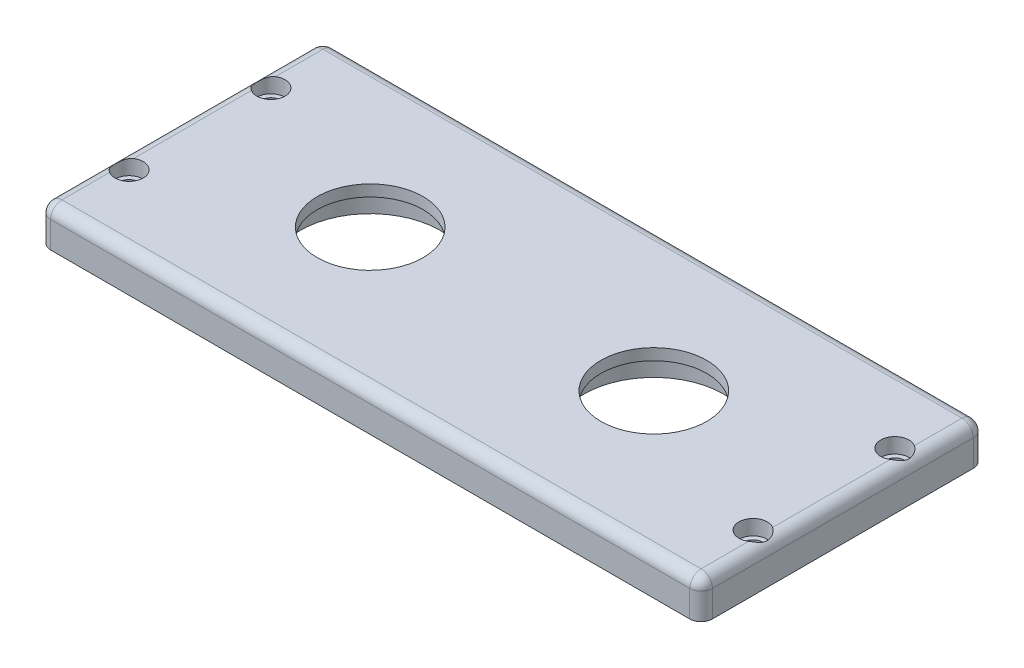
from build123d import *

# Parameters (mm, degrees)
SKETCH1_W           = 175
SKETCH1_H           = 75
BOSS_EXTRUDE1_DEPTH = 10
SKETCH2_R           = 3.75
CUT_EXTRUDE1_DEPTH  = 4
SKETCH3_R           = 2.5
CUT_EXTRUDE2_DEPTH  = 96.720948595
SKETCH4_R           = 14
CUT_EXTRUDE3_DEPTH  = 96.720948595
SKETCH5_R           = 18.5
CUT_EXTRUDE4_DEPTH  = 7
FILLET1_R           = 3


with BuildPart() as part:
    # Sketch1 → Boss-Extrude1 (new body)
    with BuildSketch(Plane(origin=(0, 0, 0), x_dir=(1, 0, 0), z_dir=(0, 1, 0))):
        Rectangle(SKETCH1_W, SKETCH1_H)
    extrude(amount=BOSS_EXTRUDE1_DEPTH)

    # Sketch2 → Cut-Extrude1 (cut)
    with BuildSketch(Plane(origin=(0, 10, 0), x_dir=(1, 0, 0), z_dir=(0, 1, 0))):
        with Locations(Location((-82.5, 18.75, 0), (0, 0, 270))):
            Circle(SKETCH2_R)
        with Locations(Location((-82.5, -18.75, 0), (0, 0, 90))):
            Circle(SKETCH2_R)
        with Locations(Location((82.5, -18.75, 0), (0, 0, 270))):
            Circle(SKETCH2_R)
        with Locations(Location((82.5, 18.75, 0), (0, 0, 90))):
            Circle(SKETCH2_R)
    extrude(amount=-CUT_EXTRUDE1_DEPTH, mode=Mode.SUBTRACT)

    # Sketch3 → Cut-Extrude2 (cut, through all)
    with BuildSketch(Plane(origin=(0, 10, 0), x_dir=(1, 0, 0), z_dir=(0, 1, 0))):
        with Locations(Location((-82.5, 18.75, 0), (0, 0, 270))):
            Circle(SKETCH3_R)
        with Locations(Location((-82.5, -18.75, 0), (0, 0, 90))):
            Circle(SKETCH3_R)
        with Locations(Location((82.5, -18.75, 0), (0, 0, 270))):
            Circle(SKETCH3_R)
        with Locations(Location((82.5, 18.75, 0), (0, 0, 90))):
            Circle(SKETCH3_R)
    extrude(amount=-CUT_EXTRUDE2_DEPTH, mode=Mode.SUBTRACT)

    # Sketch4 → Cut-Extrude3 (cut, through all)
    with BuildSketch(Plane(origin=(0, 10, 0), x_dir=(1, 0, 0), z_dir=(0, 1, 0))):
        with Locations(Location((-37.5, 0, 0), (0, 0, 270))):
            Circle(SKETCH4_R)
    cut_extrude3 = extrude(amount=-CUT_EXTRUDE3_DEPTH, mode=Mode.SUBTRACT)

    # Sketch5 → Cut-Extrude4 (cut)
    with BuildSketch(Plane.XZ):
        with Locations(Location((-37.5, 0, 0), (0, 0, 270))):
            Circle(SKETCH5_R)
    cut_extrude4 = extrude(amount=-CUT_EXTRUDE4_DEPTH, mode=Mode.SUBTRACT)

    # Mirror1: Cut-Extrude3, Cut-Extrude4 across plane
    add(cut_extrude3.mirror(Plane(origin=(0, 0, 0), x_dir=(0, 0, 1), z_dir=(1, 0, 0))), mode=Mode.SUBTRACT)
    add(cut_extrude4.mirror(Plane(origin=(0, 0, 0), x_dir=(0, 0, 1), z_dir=(1, 0, 0))), mode=Mode.SUBTRACT)

    # Fillet1
    # the kernel refuses this fillet: 3 mm, written as the material it takes off along each edge
    with BuildSketch(Plane(origin=(-84.5, 7, 34.5), x_dir=(0, 1, 0), z_dir=(-1, 0, 0))) as fillet1_piece_1_section:
        Polygon((0, 0), (FILLET1_R, 0), (FILLET1_R, -FILLET1_R), (0, -FILLET1_R), align=None)
    fillet1_piece_1 = extrude(amount=FILLET1_R, mode=Mode.PRIVATE)
    fillet1_piece_1 = fillet1_piece_1 - Plane(origin=(-84.5, 7, 34.5), x_dir=(0, -0.7071067811865475, -0.7071067811865475), z_dir=(-1, 0, 0)) * Sphere(FILLET1_R, mode=Mode.PRIVATE)
    add(fillet1_piece_1, mode=Mode.SUBTRACT)
    with BuildSketch(Plane(origin=(-84.5, 7, -34.5), x_dir=(-1, 0, 0), z_dir=(0, 0, -1))) as fillet1_piece_2_section:
        Polygon((0, 0), (FILLET1_R, 0), (FILLET1_R, FILLET1_R), (0, FILLET1_R), align=None)
    fillet1_piece_2 = extrude(amount=FILLET1_R, mode=Mode.PRIVATE)
    fillet1_piece_2 = fillet1_piece_2 - Plane(origin=(-84.5, 7, -34.5), x_dir=(0.7071067811865475, -0.7071067811865475, 0), z_dir=(0, 0, -1)) * Sphere(FILLET1_R, mode=Mode.PRIVATE)
    add(fillet1_piece_2, mode=Mode.SUBTRACT)
    with BuildSketch(Plane(origin=(84.5, 7, 34.5), x_dir=(0, 1, 0), z_dir=(1, 0, 0))) as fillet1_piece_3_section:
        Polygon((0, 0), (FILLET1_R, 0), (FILLET1_R, FILLET1_R), (0, FILLET1_R), align=None)
    fillet1_piece_3 = extrude(amount=FILLET1_R, mode=Mode.PRIVATE)
    fillet1_piece_3 = fillet1_piece_3 - Plane(origin=(84.5, 7, 34.5), x_dir=(0, -0.7071067811865475, -0.7071067811865475), z_dir=(1, 0, 0)) * Sphere(FILLET1_R, mode=Mode.PRIVATE)
    add(fillet1_piece_3, mode=Mode.SUBTRACT)
    with BuildSketch(Plane(origin=(84.5, 7, -34.5), x_dir=(1, 0, 0), z_dir=(0, 0, -1))) as fillet1_piece_4_section:
        Polygon((0, 0), (FILLET1_R, 0), (FILLET1_R, -FILLET1_R), (0, -FILLET1_R), align=None)
    fillet1_piece_4 = extrude(amount=FILLET1_R, mode=Mode.PRIVATE)
    fillet1_piece_4 = fillet1_piece_4 - Plane(origin=(84.5, 7, -34.5), x_dir=(-0.7071067811865475, -0.7071067811865475, 0), z_dir=(0, 0, -1)) * Sphere(FILLET1_R, mode=Mode.PRIVATE)
    add(fillet1_piece_4, mode=Mode.SUBTRACT)
    with BuildSketch(Plane(origin=(-87.5, 10, 34.5), x_dir=(0, -1, 0), z_dir=(0, 0, -1)), Plane(origin=(87.5, 10, -34.5), x_dir=(0, -1, 0), z_dir=(0, 0, 1))) as fillet1_piece_5:
        with BuildLine():
            CenterArc((FILLET1_R, -FILLET1_R), FILLET1_R, 90, 90)
            Line((0, -FILLET1_R), (0, 0))
            Line((0, 0), (FILLET1_R, 0))
        make_face()
    extrude(amount=69, mode=Mode.SUBTRACT)
    with BuildSketch(Plane(origin=(84.5, 10, 37.5), x_dir=(0, 0, -1), z_dir=(-1, 0, 0))) as fillet1_piece_6:
        with BuildLine():
            CenterArc((FILLET1_R, FILLET1_R), FILLET1_R, 180, 90)
            Line((0, FILLET1_R), (0, 0))
            Line((0, 0), (FILLET1_R, 0))
        make_face()
    extrude(amount=169, mode=Mode.SUBTRACT)
    with BuildSketch(Plane(origin=(87.5, -7.5, 37.5), x_dir=(0, 0, -1), z_dir=(0, 1, 0)), Plane(origin=(87.5, -7.5, -37.5), x_dir=(-1, 0, 0), z_dir=(0, 1, 0))) as fillet1_piece_7:
        with BuildLine():
            CenterArc((FILLET1_R, FILLET1_R), FILLET1_R, 180, 90)
            Line((0, FILLET1_R), (0, 0))
            Line((0, 0), (FILLET1_R, 0))
        make_face()
    extrude(amount=14.5, mode=Mode.SUBTRACT)
    with BuildSketch(Plane(origin=(-87.5, -7.5, 37.5), x_dir=(0, 0, -1), z_dir=(0, 1, 0)), Plane(origin=(-87.5, -7.5, -37.5), x_dir=(1, 0, 0), z_dir=(0, 1, 0))) as fillet1_piece_8:
        with BuildLine():
            CenterArc((FILLET1_R, -FILLET1_R), FILLET1_R, 90, 90)
            Line((0, -FILLET1_R), (0, 0))
            Line((0, 0), (FILLET1_R, 0))
        make_face()
    extrude(amount=14.5, mode=Mode.SUBTRACT)
    with BuildSketch(Plane(origin=(-84.5, 10, -37.5), x_dir=(0, -1, 0), z_dir=(1, 0, 0))) as fillet1_piece_9:
        with BuildLine():
            CenterArc((FILLET1_R, -FILLET1_R), FILLET1_R, 90, 90)
            Line((0, -FILLET1_R), (0, 0))
            Line((0, 0), (FILLET1_R, 0))
        make_face()
    extrude(amount=169, mode=Mode.SUBTRACT)


solid = part.part
